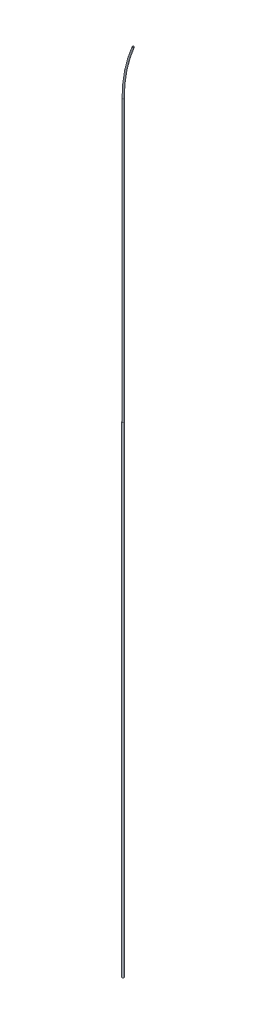
from build123d import *

# Parameters (mm, degrees)
SKETCH1_R           = 0.635
SKETCH1_R_2         = 0.498
BOSS_EXTRUDE1_DEPTH = 230
SWEEP2_OUTLINE_R    = 0.635
SWEEP2_OUTLINE_R_2  = 0.498
SWEEP2_ANGLE        = 22.918312
SKETCH4_R           = 0.8255
SKETCH4_R_2         = 0.673
BOSS_EXTRUDE2_DEPTH = 378


# Read off the part's stored shape, not the designer's step: Sweep2
with BuildPart() as part:
    # Sketch1 → Boss-Extrude1 (new body)
    with BuildSketch(Plane(origin=(0, 0, 0), x_dir=(1, 0, 0), z_dir=(0, 1, 0))):
        with Locations(Location((0, 0, 0), (0, 0, 270))):
            Circle(SKETCH1_R)
        with Locations(Location((0, 0, 0), (0, 0, 270))):
            Circle(SKETCH1_R_2, mode=Mode.SUBTRACT)
    extrude(amount=BOSS_EXTRUDE1_DEPTH)

    # Sweep2 outline → Sweep2 (revolve)
    with BuildSketch(Plane(origin=(100, 230, 0), x_dir=(-0.9210609940028842, 0.3894183423086526, 0), z_dir=(0.3894183423086526, 0.9210609940028842, 0))):
        with Locations((100, 0)):
            Circle(SWEEP2_OUTLINE_R)
        with Locations((100, 0)):
            Circle(SWEEP2_OUTLINE_R_2, mode=Mode.SUBTRACT)
    revolve(axis=Axis((100, 230, 0), (0, 0, 1)), revolution_arc=SWEEP2_ANGLE)


with BuildPart() as body_2:
    # Sketch4 → Boss-Extrude2 (new body)
    with BuildSketch(Plane(origin=(0, 10, 0), x_dir=(-1, 0, 0), z_dir=(0, -1, 0))):
        with Locations(Location((0, 0, 0), (0, 0, 90))):
            Circle(SKETCH4_R)
        with Locations(Location((0, 0, 0), (0, 0, 90))):
            Circle(SKETCH4_R_2, mode=Mode.SUBTRACT)
    extrude(amount=BOSS_EXTRUDE2_DEPTH)


solid = Compound([part.part, body_2.part])
